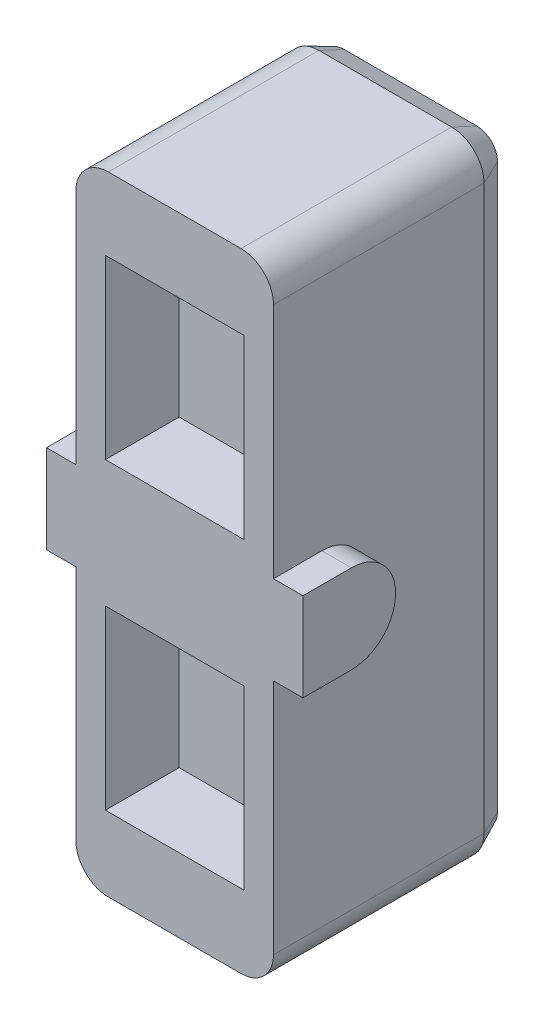
from build123d import *

# Parameters (mm, degrees)
BOSS_EXTRU_1_DEPTH      = 8
CHANFREIN1_SIZE         = 0.4
CHANFREIN1_SIZE2        = 0.857802768
BOSS_EXTRU_2_DEPTH      = 0.2
ENL_V_MAT_EXTRU_3_DEPTH = 0.2
ESQUISSE3_W             = 4.7
ESQUISSE3_H             = 6
ENL_V_MAT_EXTRU_4_DEPTH = 2.5
BOSS_EXTRU_3_DEPTH      = 1
BOSS_EXTRU_3_DEPTH_BACK = 7.7


with BuildPart() as part:
    # Esquisse2 → Boss.-Extru.1 (new body)
    with BuildSketch(Plane.XY):
        with BuildLine():
            Line((1.1, 0), (5.6, 0))
            ThreePointArc((5.6, 0), (6.377817459, 0.322182541), (6.7, 1.1))
            Line((6.7, 1.1), (6.7, 20.2))
            ThreePointArc((6.7, 20.2), (6.377817459, 20.977817459), (5.6, 21.3))
            Line((5.6, 21.3), (1.1, 21.3))
            ThreePointArc((1.1, 21.3), (0.322182541, 20.977817459), (0, 20.2))
            Line((0, 20.2), (0, 1.1))
            ThreePointArc((0, 1.1), (0.322182541, 0.322182541), (1.1, 0))
        make_face()
    extrude(amount=BOSS_EXTRU_1_DEPTH)

    # Chanfrein1
    chanfrein1_edges = [part.edges().sort_by_distance(p)[0] for p in [
        (3.35, 0, 0),
        (6.377817459, 0.322182541, 0),
        (0.322182541, 0.322182541, 0),
        (6.7, 10.65, 0),
        (0, 10.65, 0),
        (6.377817459, 20.977817459, 0),
        (0.322182541, 20.977817459, 0),
        (3.35, 21.3, 0),
    ]]
    chanfrein1_side = [part.faces().sort_by_distance(p)[0] for p in [
        (3.35, 10.65, 0),
    ]]
    chamfer(chanfrein1_edges, length=CHANFREIN1_SIZE, length2=CHANFREIN1_SIZE2, reference=chanfrein1_side[0])

    # Esquisse5<4> → Boss.-Extru.2 (add)
    # profile 1 of 5: a face of its own
    with BuildSketch(Plane.XY):
        Polygon((1.54, 5.9), (5.159538913, 5.9), (3.349812525, 1.9), align=None)
        Polygon((3.349799516, 3.355553525), (2.47002862, 5.3), (4.22952854, 5.3), align=None, mode=Mode.SUBTRACT)
    # profile 2 of 5: a face of its own
    with BuildSketch(Plane.XY):
        Polygon((1.54, 15.4), (5.16, 15.4), (3.35, 19.4), align=None)
        Polygon((2.470068334, 16), (4.229931666, 16), (3.35, 17.944600368), align=None, mode=Mode.SUBTRACT)
    # profile 3 of 5: a face of its own
    with BuildSketch(Plane.XY):
        with BuildLine():
            Line((6.075641026, 12.154141058), (5.672495994, 12.154141058))
            add(Edge.make_bspline(
                [(5.672495994, 12.154141058), (5.645948647, 12.154012027), (5.594664895, 12.153762766), (5.520846736, 12.150099205), (5.452824564, 12.144815903), (5.390935151, 12.137038821), (5.334959658, 12.126428187), (5.284909464, 12.114080553), (5.24046632, 12.099897584), (5.18953241, 12.07697466), (5.132296791, 12.041136993), (5.071993442, 11.985766647), (5.018549496, 11.918844398), (4.973038306, 11.840588225), (4.935164328, 11.753037211), (4.909144562, 11.656548858), (4.892742324, 11.552737932), (4.890762826, 11.480961988), (4.88974359, 11.44400484)],
                knots=[0, 0, 0, 0, 1.039627727, 2.00833668, 2.893894799, 3.711330588, 4.449924537, 5.123848414, 5.729630637, 6.273977409, 7.307977519, 8.358648022, 9.465487059, 10.649573196, 11.894375491, 13.190322934, 14.553308434, 16, 16, 16, 16], degree=3))
            add(Edge.make_bspline(
                [(4.88974359, 11.44400484), (4.890088186, 11.424303767), (4.890763496, 11.3856953), (4.894405149, 11.328937122), (4.902447592, 11.274910878), (4.911421441, 11.22287395), (4.924637103, 11.173619713), (4.940192748, 11.12656556), (4.958464694, 11.082038992), (4.980453546, 11.040316834), (5.004097786, 11.000571368), (5.03163336, 10.963825262), (5.06139783, 10.929306025), (5.094438696, 10.897532378), (5.129948427, 10.867873601), (5.168696197, 10.840832359), (5.210228289, 10.816226574), (5.239526977, 10.802101514), (5.254326923, 10.794966378)],
                knots=[0, 0, 0, 0, 1.194053423, 2.340003074, 3.442999494, 4.502508745, 5.537936761, 6.529597532, 7.50460804, 8.450208031, 9.385306774, 10.303844016, 11.228820201, 12.144512199, 13.078351622, 14.029723606, 15.004734115, 16, 16, 16, 16], degree=3))
            Line((5.254326923, 10.794966378), (4.809615385, 9.654141058))
            Line((4.809615385, 9.654141058), (5.204246795, 9.654141058))
            Line((5.204246795, 9.654141058), (5.628425481, 10.743884648))
            Line((5.628425481, 10.743884648), (5.723076923, 10.743884648))
            Line((5.723076923, 10.743884648), (5.723076923, 9.654141058))
            Line((5.723076923, 9.654141058), (6.075641026, 9.654141058))
            Line((6.075641026, 9.654141058), (6.075641026, 12.154141058))
        make_face()
        with BuildLine():
            Line((5.723076923, 11.192602596), (5.591866987, 11.192602596))
            add(Edge.make_bspline(
                [(5.591866987, 11.192602596), (5.575840463, 11.19284479), (5.545102457, 11.193309304), (5.500922008, 11.195431736), (5.460829482, 11.200609301), (5.424574142, 11.207146823), (5.391825112, 11.214648868), (5.363307046, 11.225398701), (5.338322299, 11.2371536), (5.310750554, 11.256080029), (5.281865863, 11.286059344), (5.258220961, 11.332500815), (5.244318315, 11.38828652), (5.243006542, 11.428559128), (5.242307692, 11.450014455)],
                knots=[0, 0, 0, 0, 1.14443165, 2.194958024, 3.155864406, 4.02787753, 4.825710302, 5.549708663, 6.200008757, 6.791751392, 7.929772656, 9.129352395, 10.470655706, 12, 12, 12, 12], degree=3))
            add(Edge.make_bspline(
                [(5.242307692, 11.450014455), (5.242799026, 11.463235795), (5.243757826, 11.4890362), (5.250907237, 11.526264589), (5.262353723, 11.560992713), (5.279053681, 11.592297793), (5.299015388, 11.620652732), (5.322674116, 11.644858939), (5.349557891, 11.664649446), (5.381004798, 11.680719968), (5.420813219, 11.692219935), (5.471888785, 11.700207675), (5.535860062, 11.704849784), (5.582844419, 11.705221162), (5.608393429, 11.705423109)],
                knots=[0, 0, 0, 0, 0.924337365, 1.803771715, 2.642005932, 3.472477419, 4.2760797, 5.0605346, 5.828920279, 6.601817847, 7.517857049, 8.713834682, 10.213058996, 12, 12, 12, 12], degree=3))
            Line((5.608393429, 11.705423109), (5.723076923, 11.705423109))
            Line((5.723076923, 11.705423109), (5.723076923, 11.192602596))
        make_face(mode=Mode.SUBTRACT)
    # profile 4 of 5: a face of its own
    with BuildSketch(Plane.XY):
        Polygon((4.505128205, 12.154141058), (4.172596154, 12.154141058), (3.319230769, 10.509008846), (3.319230769, 12.154141058), (2.966666667, 12.154141058), (2.966666667, 9.654141058), (3.301702724, 9.654141058), (4.152564103, 11.294265257), (4.152564103, 9.654141058), (4.505128205, 9.654141058), align=None)
    # profile 5 of 5: a face of its own
    with BuildSketch(Plane.XY):
        with BuildLine():
            Line((0.731089744, 11.75650484), (0.995012019, 11.431484808))
            add(Edge.make_bspline(
                [(0.995012019, 11.431484808), (1.015921934, 11.458244882), (1.056394931, 11.510041383), (1.122905185, 11.579260941), (1.192184692, 11.637767517), (1.26416915, 11.685861676), (1.338949153, 11.723479342), (1.416391074, 11.750167834), (1.496659001, 11.766203406), (1.550996525, 11.768410662), (1.578445513, 11.769525673)],
                knots=[0, 0, 0, 0, 1.162569996, 2.250257521, 3.280960514, 4.262508183, 5.208546176, 6.139695973, 7.060254147, 8, 8, 8, 8], degree=3))
            add(Edge.make_bspline(
                [(1.578445513, 11.769525673), (1.602192158, 11.76872068), (1.649133138, 11.767129417), (1.718004379, 11.755549379), (1.783752958, 11.73560282), (1.846756722, 11.708767663), (1.906207915, 11.672942199), (1.963211907, 11.630279159), (2.016790273, 11.57923519), (2.066902307, 11.521425734), (2.112749006, 11.458403302), (2.15242626, 11.390872015), (2.185975691, 11.320105216), (2.21381991, 11.245941862), (2.235054055, 11.168445486), (2.250860914, 11.087636066), (2.259822159, 11.003504551), (2.260960672, 10.946228928), (2.261538462, 10.917161891)],
                knots=[0, 0, 0, 0, 0.938427293, 1.855028254, 2.750559532, 3.649002957, 4.554277097, 5.487260679, 6.458112854, 7.472967846, 8.507704688, 9.534076982, 10.56411184, 11.599710848, 12.661054299, 13.736395705, 14.851234316, 16, 16, 16, 16], degree=3))
            add(Edge.make_bspline(
                [(2.261538462, 10.917161891), (2.261073579, 10.887082451), (2.260159165, 10.827916933), (2.249605751, 10.741054213), (2.23369087, 10.65768359), (2.211916725, 10.57753948), (2.182495261, 10.501328626), (2.14747737, 10.428280037), (2.105709315, 10.358865616), (2.057811913, 10.29393755), (2.00612242, 10.233819413), (1.949438213, 10.182323226), (1.890885409, 10.137305562), (1.828195764, 10.101984998), (1.763241727, 10.073367077), (1.695080376, 10.053410729), (1.623974546, 10.040961515), (1.575492416, 10.039498506), (1.550901442, 10.038756443)],
                knots=[0, 0, 0, 0, 1.148957322, 2.259970722, 3.338473738, 4.390945319, 5.428834093, 6.456021376, 7.483367133, 8.51947018, 9.536703863, 10.507423661, 11.441391095, 12.352953102, 13.250114251, 14.148363472, 15.060817986, 16, 16, 16, 16], degree=3))
            add(Edge.make_bspline(
                [(1.550901442, 10.038756443), (1.534856632, 10.038941734), (1.503333582, 10.039305773), (1.457165589, 10.045231662), (1.412983625, 10.053663784), (1.370425389, 10.065029292), (1.330148116, 10.08064349), (1.291580319, 10.099345705), (1.254977082, 10.121380923), (1.220254349, 10.147027005), (1.187469045, 10.176581341), (1.155931981, 10.209247024), (1.126883252, 10.246555457), (1.098592117, 10.286875914), (1.073017304, 10.331868834), (1.047471498, 10.3796982), (1.025289776, 10.432284847), (1.011578423, 10.468731428), (1.004527244, 10.487474391)],
                knots=[0, 0, 0, 0, 1.009433297, 1.983221678, 2.925183546, 3.840502028, 4.752011326, 5.640384745, 6.536187199, 7.437950061, 8.35350986, 9.312439097, 10.292333503, 11.327268651, 12.410594007, 13.548179697, 14.73913061, 16, 16, 16, 16], degree=3))
            Line((1.004527244, 10.487474391), (1.556410256, 10.487474391))
            Line((1.556410256, 10.487474391), (1.556410256, 10.93619234))
            Line((1.556410256, 10.93619234), (0.597375801, 10.93619234))
            Line((0.597375801, 10.93619234), (0.594871795, 10.829521667))
            add(Edge.make_bspline(
                [(0.594871795, 10.829521667), (0.59527027, 10.802135312), (0.596065745, 10.747464044), (0.602058607, 10.666017756), (0.61273573, 10.585650527), (0.62721881, 10.506408554), (0.645844508, 10.428202764), (0.668147004, 10.350995204), (0.695598381, 10.275115011), (0.726281643, 10.200723495), (0.760044801, 10.128927383), (0.796751426, 10.06110302), (0.835667083, 9.99742886), (0.877285395, 9.938187768), (0.921378582, 9.883405249), (0.96803215, 9.833333855), (1.01689258, 9.787289107), (1.068258044, 9.74589155), (1.12204423, 9.708968052), (1.178383847, 9.677553653), (1.236513741, 9.650281195), (1.296991808, 9.628142003), (1.359822334, 9.611034477), (1.425030964, 9.599325587), (1.492446746, 9.59137451), (1.538191021, 9.590488418), (1.561418269, 9.590038494)],
                knots=[0, 0, 0, 0, 1.128009698, 2.251841139, 3.361446829, 4.466013101, 5.568437079, 6.671632761, 7.774314034, 8.890356461, 9.985357348, 11.04064822, 12.065458456, 13.057448214, 14.020710771, 14.959715157, 15.874257383, 16.783823037, 17.674478921, 18.55807308, 19.437886768, 20.316732623, 21.20746813, 22.116461811, 23.043609094, 24, 24, 24, 24], degree=3))
            add(Edge.make_bspline(
                [(1.561418269, 9.590038494), (1.586313125, 9.590473297), (1.635567852, 9.591333559), (1.708416023, 9.599593852), (1.779049704, 9.613073288), (1.847643242, 9.631816124), (1.914400365, 9.655248168), (1.979150303, 9.684259069), (2.041435439, 9.719344326), (2.102016827, 9.758533079), (2.159574973, 9.803350993), (2.214330858, 9.852527836), (2.265957634, 9.906324496), (2.314733807, 9.964379381), (2.359509853, 10.027453285), (2.402623448, 10.094014993), (2.441339241, 10.165943955), (2.477331484, 10.241577332), (2.509078218, 10.320469876), (2.537118093, 10.401198237), (2.561487642, 10.48328353), (2.580215804, 10.567203648), (2.595309772, 10.652422776), (2.606367362, 10.739142945), (2.613070955, 10.82741098), (2.613757044, 10.886768292), (2.614102564, 10.91666109)],
                knots=[0, 0, 0, 0, 0.949407547, 1.878412524, 2.792654211, 3.690220038, 4.58853108, 5.489254184, 6.392944044, 7.3131988, 8.23925243, 9.172699515, 10.118512105, 11.08147073, 12.062371635, 13.06755144, 14.104877296, 15.175960345, 16.261560333, 17.347104283, 18.435316132, 19.526003456, 20.625338713, 21.735923335, 22.859793629, 24, 24, 24, 24], degree=3))
            add(Edge.make_bspline(
                [(2.614102564, 10.91666109), (2.613357406, 10.957423611), (2.611888192, 11.037794238), (2.599517081, 11.156285464), (2.579674438, 11.27081282), (2.55149318, 11.381074636), (2.516009699, 11.487598015), (2.471657799, 11.589532885), (2.42025762, 11.688264689), (2.379292185, 11.750001532), (2.35869391, 11.781044103)],
                knots=[0, 0, 0, 0, 1.068286482, 2.10631857, 3.119254948, 4.112645344, 5.086824908, 6.059017212, 7.024033399, 8, 8, 8, 8], degree=3))
            add(Edge.make_bspline(
                [(2.35869391, 11.781044103), (2.346039521, 11.798889777), (2.321091216, 11.834072772), (2.280803167, 11.88344671), (2.239811843, 11.930011278), (2.196673148, 11.972335157), (2.152408361, 12.011653687), (2.106906036, 12.047807215), (2.059731732, 12.080436683), (2.011051102, 12.109547178), (1.960885379, 12.135228082), (1.909179117, 12.15699601), (1.856585578, 12.176520557), (1.802162533, 12.191170139), (1.746565779, 12.203486917), (1.689300191, 12.211656028), (1.630657114, 12.21768786), (1.590981746, 12.218057062), (1.570933494, 12.218243622)],
                knots=[0, 0, 0, 0, 1.116341401, 2.200882561, 3.250969899, 4.28126982, 5.283240038, 6.271971392, 7.245756979, 8.20874655, 9.165230382, 10.119586497, 11.071047385, 12.026125935, 12.993778557, 13.975879, 14.97719687, 16, 16, 16, 16], degree=3))
            add(Edge.make_bspline(
                [(1.570933494, 12.218243622), (1.549886595, 12.217837497), (1.508222304, 12.217033534), (1.446201683, 12.211236862), (1.385088944, 12.202484694), (1.32510363, 12.189287107), (1.266123291, 12.172885053), (1.208441011, 12.151968446), (1.151379388, 12.12834376), (1.11458492, 12.109488983), (1.096173878, 12.100054519)],
                knots=[0, 0, 0, 0, 1.021908586, 2.022963016, 3.022637993, 4.017965106, 5.003406046, 5.993105494, 6.995799654, 8, 8, 8, 8], degree=3))
            add(Edge.make_bspline(
                [(1.096173878, 12.100054519), (1.08047469, 12.091319969), (1.048414904, 12.073482879), (1.002642209, 12.040793101), (0.956340301, 12.004752927), (0.91013366, 11.964164436), (0.864866503, 11.918474904), (0.819648645, 11.868631724), (0.774461744, 11.814675747), (0.745760612, 11.776181537), (0.731089744, 11.75650484)],
                knots=[0, 0, 0, 0, 0.852576279, 1.741071806, 2.667250814, 3.639030165, 4.659304158, 5.720020043, 6.834565662, 8, 8, 8, 8], degree=3))
        make_face()
    extrude(amount=-BOSS_EXTRU_2_DEPTH)

    # Esquisse5 → Enlèv. mat.-Extru.3 (cut)
    # profile 1 of 5: a face of its own
    with BuildSketch(Plane.XY):
        Polygon((1.54, 5.9), (5.159538913, 5.9), (3.349812525, 1.9), align=None)
        Polygon((3.349799516, 3.355553525), (2.47002862, 5.3), (4.22952854, 5.3), align=None, mode=Mode.SUBTRACT)
    # profile 2 of 5: a face of its own
    with BuildSketch(Plane.XY):
        Polygon((1.54, 15.4), (5.16, 15.4), (3.35, 19.4), align=None)
        Polygon((2.470068334, 16), (4.229931666, 16), (3.35, 17.944600368), align=None, mode=Mode.SUBTRACT)
    # profile 3 of 5: a face of its own
    with BuildSketch(Plane.XY):
        with BuildLine():
            Line((6.075641026, 12.154141058), (5.672495994, 12.154141058))
            add(Edge.make_bspline(
                [(5.672495994, 12.154141058), (5.645948647, 12.154012027), (5.594664895, 12.153762766), (5.520846736, 12.150099205), (5.452824564, 12.144815903), (5.390935151, 12.137038821), (5.334959658, 12.126428187), (5.284909464, 12.114080553), (5.24046632, 12.099897584), (5.18953241, 12.07697466), (5.132296791, 12.041136993), (5.071993442, 11.985766647), (5.018549496, 11.918844398), (4.973038306, 11.840588225), (4.935164328, 11.753037211), (4.909144562, 11.656548858), (4.892742324, 11.552737932), (4.890762826, 11.480961988), (4.88974359, 11.44400484)],
                knots=[0, 0, 0, 0, 1.039627727, 2.00833668, 2.893894799, 3.711330588, 4.449924537, 5.123848414, 5.729630637, 6.273977409, 7.307977519, 8.358648022, 9.465487059, 10.649573196, 11.894375491, 13.190322934, 14.553308434, 16, 16, 16, 16], degree=3))
            add(Edge.make_bspline(
                [(4.88974359, 11.44400484), (4.890088186, 11.424303767), (4.890763496, 11.3856953), (4.894405149, 11.328937122), (4.902447592, 11.274910878), (4.911421441, 11.22287395), (4.924637103, 11.173619713), (4.940192748, 11.12656556), (4.958464694, 11.082038992), (4.980453546, 11.040316834), (5.004097786, 11.000571368), (5.03163336, 10.963825262), (5.06139783, 10.929306025), (5.094438696, 10.897532378), (5.129948427, 10.867873601), (5.168696197, 10.840832359), (5.210228289, 10.816226574), (5.239526977, 10.802101514), (5.254326923, 10.794966378)],
                knots=[0, 0, 0, 0, 1.194053423, 2.340003074, 3.442999494, 4.502508745, 5.537936761, 6.529597532, 7.50460804, 8.450208031, 9.385306774, 10.303844016, 11.228820201, 12.144512199, 13.078351622, 14.029723606, 15.004734115, 16, 16, 16, 16], degree=3))
            Line((5.254326923, 10.794966378), (4.809615385, 9.654141058))
            Line((4.809615385, 9.654141058), (5.204246795, 9.654141058))
            Line((5.204246795, 9.654141058), (5.628425481, 10.743884648))
            Line((5.628425481, 10.743884648), (5.723076923, 10.743884648))
            Line((5.723076923, 10.743884648), (5.723076923, 9.654141058))
            Line((5.723076923, 9.654141058), (6.075641026, 9.654141058))
            Line((6.075641026, 9.654141058), (6.075641026, 12.154141058))
        make_face()
        with BuildLine():
            Line((5.723076923, 11.192602596), (5.591866987, 11.192602596))
            add(Edge.make_bspline(
                [(5.591866987, 11.192602596), (5.575840463, 11.19284479), (5.545102457, 11.193309304), (5.500922008, 11.195431736), (5.460829482, 11.200609301), (5.424574142, 11.207146823), (5.391825112, 11.214648868), (5.363307046, 11.225398701), (5.338322299, 11.2371536), (5.310750554, 11.256080029), (5.281865863, 11.286059344), (5.258220961, 11.332500815), (5.244318315, 11.38828652), (5.243006542, 11.428559128), (5.242307692, 11.450014455)],
                knots=[0, 0, 0, 0, 1.14443165, 2.194958024, 3.155864406, 4.02787753, 4.825710302, 5.549708663, 6.200008757, 6.791751392, 7.929772656, 9.129352395, 10.470655706, 12, 12, 12, 12], degree=3))
            add(Edge.make_bspline(
                [(5.242307692, 11.450014455), (5.242799026, 11.463235795), (5.243757826, 11.4890362), (5.250907237, 11.526264589), (5.262353723, 11.560992713), (5.279053681, 11.592297793), (5.299015388, 11.620652732), (5.322674116, 11.644858939), (5.349557891, 11.664649446), (5.381004798, 11.680719968), (5.420813219, 11.692219935), (5.471888785, 11.700207675), (5.535860062, 11.704849784), (5.582844419, 11.705221162), (5.608393429, 11.705423109)],
                knots=[0, 0, 0, 0, 0.924337365, 1.803771715, 2.642005932, 3.472477419, 4.2760797, 5.0605346, 5.828920279, 6.601817847, 7.517857049, 8.713834682, 10.213058996, 12, 12, 12, 12], degree=3))
            Line((5.608393429, 11.705423109), (5.723076923, 11.705423109))
            Line((5.723076923, 11.705423109), (5.723076923, 11.192602596))
        make_face(mode=Mode.SUBTRACT)
    # profile 4 of 5: a face of its own
    with BuildSketch(Plane.XY):
        Polygon((4.505128205, 12.154141058), (4.172596154, 12.154141058), (3.319230769, 10.509008846), (3.319230769, 12.154141058), (2.966666667, 12.154141058), (2.966666667, 9.654141058), (3.301702724, 9.654141058), (4.152564103, 11.294265257), (4.152564103, 9.654141058), (4.505128205, 9.654141058), align=None)
    # profile 5 of 5: a face of its own
    with BuildSketch(Plane.XY):
        with BuildLine():
            Line((0.731089744, 11.75650484), (0.995012019, 11.431484808))
            add(Edge.make_bspline(
                [(0.995012019, 11.431484808), (1.015921934, 11.458244882), (1.056394931, 11.510041383), (1.122905185, 11.579260941), (1.192184692, 11.637767517), (1.26416915, 11.685861676), (1.338949153, 11.723479342), (1.416391074, 11.750167834), (1.496659001, 11.766203406), (1.550996525, 11.768410662), (1.578445513, 11.769525673)],
                knots=[0, 0, 0, 0, 1.162569996, 2.250257521, 3.280960514, 4.262508183, 5.208546176, 6.139695973, 7.060254147, 8, 8, 8, 8], degree=3))
            add(Edge.make_bspline(
                [(1.578445513, 11.769525673), (1.602192158, 11.76872068), (1.649133138, 11.767129417), (1.718004379, 11.755549379), (1.783752958, 11.73560282), (1.846756722, 11.708767663), (1.906207915, 11.672942199), (1.963211907, 11.630279159), (2.016790273, 11.57923519), (2.066902307, 11.521425734), (2.112749006, 11.458403302), (2.15242626, 11.390872015), (2.185975691, 11.320105216), (2.21381991, 11.245941862), (2.235054055, 11.168445486), (2.250860914, 11.087636066), (2.259822159, 11.003504551), (2.260960672, 10.946228928), (2.261538462, 10.917161891)],
                knots=[0, 0, 0, 0, 0.938427293, 1.855028254, 2.750559532, 3.649002957, 4.554277097, 5.487260679, 6.458112854, 7.472967846, 8.507704688, 9.534076982, 10.56411184, 11.599710848, 12.661054299, 13.736395705, 14.851234316, 16, 16, 16, 16], degree=3))
            add(Edge.make_bspline(
                [(2.261538462, 10.917161891), (2.261073579, 10.887082451), (2.260159165, 10.827916933), (2.249605751, 10.741054213), (2.23369087, 10.65768359), (2.211916725, 10.57753948), (2.182495261, 10.501328626), (2.14747737, 10.428280037), (2.105709315, 10.358865616), (2.057811913, 10.29393755), (2.00612242, 10.233819413), (1.949438213, 10.182323226), (1.890885409, 10.137305562), (1.828195764, 10.101984998), (1.763241727, 10.073367077), (1.695080376, 10.053410729), (1.623974546, 10.040961515), (1.575492416, 10.039498506), (1.550901442, 10.038756443)],
                knots=[0, 0, 0, 0, 1.148957322, 2.259970722, 3.338473738, 4.390945319, 5.428834093, 6.456021376, 7.483367133, 8.51947018, 9.536703863, 10.507423661, 11.441391095, 12.352953102, 13.250114251, 14.148363472, 15.060817986, 16, 16, 16, 16], degree=3))
            add(Edge.make_bspline(
                [(1.550901442, 10.038756443), (1.534856632, 10.038941734), (1.503333582, 10.039305773), (1.457165589, 10.045231662), (1.412983625, 10.053663784), (1.370425389, 10.065029292), (1.330148116, 10.08064349), (1.291580319, 10.099345705), (1.254977082, 10.121380923), (1.220254349, 10.147027005), (1.187469045, 10.176581341), (1.155931981, 10.209247024), (1.126883252, 10.246555457), (1.098592117, 10.286875914), (1.073017304, 10.331868834), (1.047471498, 10.3796982), (1.025289776, 10.432284847), (1.011578423, 10.468731428), (1.004527244, 10.487474391)],
                knots=[0, 0, 0, 0, 1.009433297, 1.983221678, 2.925183546, 3.840502028, 4.752011326, 5.640384745, 6.536187199, 7.437950061, 8.35350986, 9.312439097, 10.292333503, 11.327268651, 12.410594007, 13.548179697, 14.73913061, 16, 16, 16, 16], degree=3))
            Line((1.004527244, 10.487474391), (1.556410256, 10.487474391))
            Line((1.556410256, 10.487474391), (1.556410256, 10.93619234))
            Line((1.556410256, 10.93619234), (0.597375801, 10.93619234))
            Line((0.597375801, 10.93619234), (0.594871795, 10.829521667))
            add(Edge.make_bspline(
                [(0.594871795, 10.829521667), (0.59527027, 10.802135312), (0.596065745, 10.747464044), (0.602058607, 10.666017756), (0.61273573, 10.585650527), (0.62721881, 10.506408554), (0.645844508, 10.428202764), (0.668147004, 10.350995204), (0.695598381, 10.275115011), (0.726281643, 10.200723495), (0.760044801, 10.128927383), (0.796751426, 10.06110302), (0.835667083, 9.99742886), (0.877285395, 9.938187768), (0.921378582, 9.883405249), (0.96803215, 9.833333855), (1.01689258, 9.787289107), (1.068258044, 9.74589155), (1.12204423, 9.708968052), (1.178383847, 9.677553653), (1.236513741, 9.650281195), (1.296991808, 9.628142003), (1.359822334, 9.611034477), (1.425030964, 9.599325587), (1.492446746, 9.59137451), (1.538191021, 9.590488418), (1.561418269, 9.590038494)],
                knots=[0, 0, 0, 0, 1.128009698, 2.251841139, 3.361446829, 4.466013101, 5.568437079, 6.671632761, 7.774314034, 8.890356461, 9.985357348, 11.04064822, 12.065458456, 13.057448214, 14.020710771, 14.959715157, 15.874257383, 16.783823037, 17.674478921, 18.55807308, 19.437886768, 20.316732623, 21.20746813, 22.116461811, 23.043609094, 24, 24, 24, 24], degree=3))
            add(Edge.make_bspline(
                [(1.561418269, 9.590038494), (1.586313125, 9.590473297), (1.635567852, 9.591333559), (1.708416023, 9.599593852), (1.779049704, 9.613073288), (1.847643242, 9.631816124), (1.914400365, 9.655248168), (1.979150303, 9.684259069), (2.041435439, 9.719344326), (2.102016827, 9.758533079), (2.159574973, 9.803350993), (2.214330858, 9.852527836), (2.265957634, 9.906324496), (2.314733807, 9.964379381), (2.359509853, 10.027453285), (2.402623448, 10.094014993), (2.441339241, 10.165943955), (2.477331484, 10.241577332), (2.509078218, 10.320469876), (2.537118093, 10.401198237), (2.561487642, 10.48328353), (2.580215804, 10.567203648), (2.595309772, 10.652422776), (2.606367362, 10.739142945), (2.613070955, 10.82741098), (2.613757044, 10.886768292), (2.614102564, 10.91666109)],
                knots=[0, 0, 0, 0, 0.949407547, 1.878412524, 2.792654211, 3.690220038, 4.58853108, 5.489254184, 6.392944044, 7.3131988, 8.23925243, 9.172699515, 10.118512105, 11.08147073, 12.062371635, 13.06755144, 14.104877296, 15.175960345, 16.261560333, 17.347104283, 18.435316132, 19.526003456, 20.625338713, 21.735923335, 22.859793629, 24, 24, 24, 24], degree=3))
            add(Edge.make_bspline(
                [(2.614102564, 10.91666109), (2.613357406, 10.957423611), (2.611888192, 11.037794238), (2.599517081, 11.156285464), (2.579674438, 11.27081282), (2.55149318, 11.381074636), (2.516009699, 11.487598015), (2.471657799, 11.589532885), (2.42025762, 11.688264689), (2.379292185, 11.750001532), (2.35869391, 11.781044103)],
                knots=[0, 0, 0, 0, 1.068286482, 2.10631857, 3.119254948, 4.112645344, 5.086824908, 6.059017212, 7.024033399, 8, 8, 8, 8], degree=3))
            add(Edge.make_bspline(
                [(2.35869391, 11.781044103), (2.346039521, 11.798889777), (2.321091216, 11.834072772), (2.280803167, 11.88344671), (2.239811843, 11.930011278), (2.196673148, 11.972335157), (2.152408361, 12.011653687), (2.106906036, 12.047807215), (2.059731732, 12.080436683), (2.011051102, 12.109547178), (1.960885379, 12.135228082), (1.909179117, 12.15699601), (1.856585578, 12.176520557), (1.802162533, 12.191170139), (1.746565779, 12.203486917), (1.689300191, 12.211656028), (1.630657114, 12.21768786), (1.590981746, 12.218057062), (1.570933494, 12.218243622)],
                knots=[0, 0, 0, 0, 1.116341401, 2.200882561, 3.250969899, 4.28126982, 5.283240038, 6.271971392, 7.245756979, 8.20874655, 9.165230382, 10.119586497, 11.071047385, 12.026125935, 12.993778557, 13.975879, 14.97719687, 16, 16, 16, 16], degree=3))
            add(Edge.make_bspline(
                [(1.570933494, 12.218243622), (1.549886595, 12.217837497), (1.508222304, 12.217033534), (1.446201683, 12.211236862), (1.385088944, 12.202484694), (1.32510363, 12.189287107), (1.266123291, 12.172885053), (1.208441011, 12.151968446), (1.151379388, 12.12834376), (1.11458492, 12.109488983), (1.096173878, 12.100054519)],
                knots=[0, 0, 0, 0, 1.021908586, 2.022963016, 3.022637993, 4.017965106, 5.003406046, 5.993105494, 6.995799654, 8, 8, 8, 8], degree=3))
            add(Edge.make_bspline(
                [(1.096173878, 12.100054519), (1.08047469, 12.091319969), (1.048414904, 12.073482879), (1.002642209, 12.040793101), (0.956340301, 12.004752927), (0.91013366, 11.964164436), (0.864866503, 11.918474904), (0.819648645, 11.868631724), (0.774461744, 11.814675747), (0.745760612, 11.776181537), (0.731089744, 11.75650484)],
                knots=[0, 0, 0, 0, 0.852576279, 1.741071806, 2.667250814, 3.639030165, 4.659304158, 5.720020043, 6.834565662, 8, 8, 8, 8], degree=3))
        make_face()
    extrude(amount=ENL_V_MAT_EXTRU_3_DEPTH, mode=Mode.SUBTRACT)


with BuildPart() as enl_v_mat_extru_3_piece_1:
    # of the separate pieces the step leaves, piece 1, a body of its own (enl_v_mat_extru_3_pieces)
    add(part.part.solids().sort_by_distance((0, 20.2, 0.857802768))[0])

    # Esquisse3 → Enlèv. mat.-Extru.4 (cut)
    with BuildSketch(Plane.XY.offset(8)):
        with Locations((3.35, 15.8)):
            Rectangle(ESQUISSE3_W, ESQUISSE3_H)
        with Locations((3.35, 5.5)):
            Rectangle(ESQUISSE3_W, ESQUISSE3_H)
    extrude(amount=-ENL_V_MAT_EXTRU_4_DEPTH, mode=Mode.SUBTRACT)

    # Esquisse6 → Boss.-Extru.3 (add, two sides: drawn at the far end of the back side and taken through both)
    with BuildSketch(Plane.ZY.offset(-BOSS_EXTRU_3_DEPTH_BACK)):
        with BuildLine():
            Line((6.357802768, 12.15), (8, 12.15))
            Line((8, 12.15), (8, 9.15))
            Line((8, 9.15), (6.357802768, 9.15))
            ThreePointArc((6.357802768, 9.15), (4.857802768, 10.65), (6.357802768, 12.15))
        make_face()
    extrude(amount=BOSS_EXTRU_3_DEPTH + BOSS_EXTRU_3_DEPTH_BACK)


with BuildPart() as enl_v_mat_extru_3_piece_2:
    # of the separate pieces the step leaves, piece 2, a body of its own (enl_v_mat_extru_3_pieces)
    add(part.part.solids().sort_by_distance((1.54, 15.4, -0.2))[0])


with BuildPart() as enl_v_mat_extru_3_piece_3:
    # of the separate pieces the step leaves, piece 3, a body of its own (enl_v_mat_extru_3_pieces)
    add(part.part.solids().sort_by_distance((3.349812525, 1.9, -0.2))[0])


with BuildPart() as enl_v_mat_extru_3_piece_4:
    # of the separate pieces the step leaves, piece 4, a body of its own (enl_v_mat_extru_3_pieces)
    add(part.part.solids().sort_by_distance((0.731089744, 11.75650484, -0.2))[0])


with BuildPart() as enl_v_mat_extru_3_piece_5:
    # of the separate pieces the step leaves, piece 5, a body of its own (enl_v_mat_extru_3_pieces)
    add(part.part.solids().sort_by_distance((4.505128205, 12.154141058, -0.2))[0])


with BuildPart() as enl_v_mat_extru_3_piece_6:
    # of the separate pieces the step leaves, piece 6, a body of its own (enl_v_mat_extru_3_pieces)
    add(part.part.solids().sort_by_distance((6.075641026, 12.154141058, -0.2))[0])


solid = Compound([enl_v_mat_extru_3_piece_1.part, enl_v_mat_extru_3_piece_2.part, enl_v_mat_extru_3_piece_3.part, enl_v_mat_extru_3_piece_4.part, enl_v_mat_extru_3_piece_5.part, enl_v_mat_extru_3_piece_6.part])
